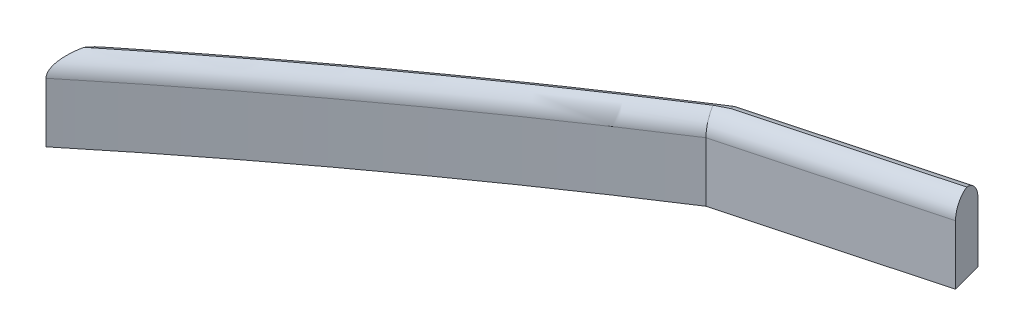
from build123d import *

# Parameters (mm, degrees)
EXTRUDE_1_DEPTH = 4
FILLET_1_R      = 1


with BuildPart() as part:
    # 草图1 → 凸台-拉伸1 (new body)
    with BuildSketch(Plane(origin=(0, 0, 0), x_dir=(1, 0, 0), z_dir=(0, 1, 0))):
        with BuildLine():
            Line((-5.928068954, -6.449296909), (-4.820160255, -3.746554363))
            ThreePointArc((-4.820160255, -3.746554363), (4.093177489, 3.01181264), (13.350341007, 9.290987577))
            Line((13.350341007, 9.290987577), (22.871021424, 11.851023114))
            Line((22.871021424, 11.851023114), (23.289072647, 10.296305596))
            Line((23.289072647, 10.296305596), (13.350341007, 7.623859397))
            ThreePointArc((13.350341007, 7.623859397), (3.511743095, 0.860423855), (-5.928068954, -6.449296909))
        make_face()
    extrude(amount=EXTRUDE_1_DEPTH)

    # 圆角1
    # the kernel refuses this fillet: 1 mm, written as the material it takes off along each edge
    with BuildSketch(Plane(origin=(127.771889532, 4, 169.359958319), x_dir=(-0.6341416592780885, 0, -0.7732168880514914), z_dir=(-0.7732168880514914, 0, 0.6341416592780885))) as fillet_1_piece_1:
        with BuildLine():
            CenterArc((212.151953176 - FILLET_1_R, FILLET_1_R), FILLET_1_R, 270, 90)
            Line((212.151953176 - FILLET_1_R, 0), (212.151953176, 0))
            Line((212.151953176, 0), (212.151953176, FILLET_1_R))
        make_face()
    revolve(axis=Axis((127.771889532, 4, 169.359958319), (0, -1, 0)), revolution_arc=7.865584332, mode=Mode.SUBTRACT)
    # the kernel refuses this fillet: 1 mm, written as the material it takes off along each edge
    with BuildSketch(Plane(origin=(12.521058721, 4, -9.06800014), x_dir=(0.2596684924125265, 0, 0.9656978171499642), z_dir=(0.9656978171499642, 0, -0.2596684924125265))) as fillet_1_2_piece_1:
        with BuildLine():
            CenterArc((FILLET_1_R, FILLET_1_R), FILLET_1_R, 180, 90)
            Line((0, FILLET_1_R), (0, 0))
            Line((0, 0), (FILLET_1_R, 0))
        make_face()
    extrude(amount=13.21759977, mode=Mode.SUBTRACT)
    # the kernel refuses this fillet: 1 mm, written as the material it takes off along each edge
    with BuildSketch(Plane(origin=(25.70331719, 4, -10.945476827), x_dir=(-0.25966849241252477, 0, -0.9656978171499647), z_dir=(-0.9656978171499647, 0, 0.25966849241252477))) as fillet_1_3_piece_1_section:
        with BuildLine():
            CenterArc((FILLET_1_R, FILLET_1_R), FILLET_1_R, 180, 90)
            Line((0, FILLET_1_R), (0, 0))
            Line((0, 0), (FILLET_1_R, 0))
        make_face()
    fillet_1_3_piece_1 = extrude(amount=15.291761526, mode=Mode.PRIVATE)
    fillet_1_3_piece_1 = fillet_1_3_piece_1 & Plane(origin=(127.771889532, 4, 169.359958319), x_dir=(-0.5429254971555654, 0, -0.8397808669756547), z_dir=(0, -1, 0)) * Cylinder(210.75, 35, mode=Mode.PRIVATE)
    add(fillet_1_3_piece_1, mode=Mode.SUBTRACT)
    # the kernel refuses this fillet: 1 mm, written as the material it takes off along each edge
    with BuildSketch(Plane(origin=(127.771889532, 4, 169.359958319), x_dir=(-0.6435256080636699, 0, -0.765424582677016), z_dir=(-0.765424582677016, 0, 0.6435256080636699))) as fillet_1_4_piece_1_section:
        with BuildLine():
            CenterArc((210.75 + FILLET_1_R, FILLET_1_R), FILLET_1_R, 180, 90)
            Line((210.75 + FILLET_1_R, 0), (210.75, 0))
            Line((210.75, 0), (210.75, FILLET_1_R))
        make_face()
    fillet_1_4_piece_1 = revolve(axis=Axis((127.771889532, 4, 169.359958319), (0, -1, 0)), revolution_arc=8.877330019, mode=Mode.PRIVATE)
    fillet_1_4_piece_1 = fillet_1_4_piece_1 - Plane(origin=(75.416344667, 3, -25.348436689), x_dir=(0, 1, 0), z_dir=(0.9656978171499647, 0, -0.25966849241252477)) * Cylinder(1, 848, mode=Mode.PRIVATE)
    add(fillet_1_4_piece_1, mode=Mode.SUBTRACT)


solid = part.part
